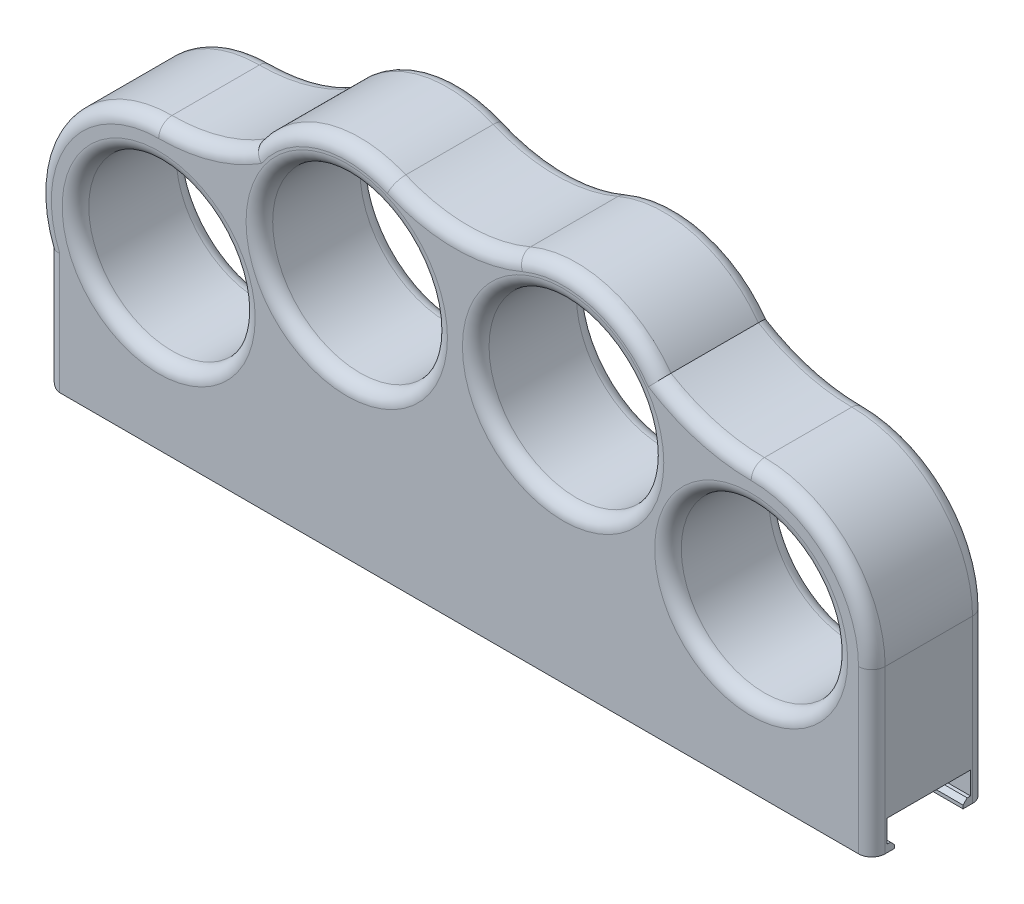
from build123d import *

# Parameters (mm, degrees)
CROQUIS1_R              = 10
CROQUIS1_R_2            = 10.5
SALIENTE_EXTRUIR1_DEPTH = 13.7
REDONDEO2_R             = 1.6
CROQUIS2_W              = 89.2
CROQUIS2_H              = 10.02
CORTAR_EXTRUIR1_DEPTH   = 3.6
SALIENTE_EXTRUIR3_DEPTH = 0.8999
CHAFL_N1_SIZE           = 0.5
REDONDEO6_R             = 1.6
CHAFL_N3_SIZE           = 0.5


with BuildPart() as part:
    # Croquis1 → Saliente-Extruir1 (new body)
    with BuildSketch(Plane.XY):
        with BuildLine():
            Line((-49.1, -10.791502622), (-49.1, -23))
            Line((-49.1, -23), (-49.1, -25))
            Line((-49.1, -25), (-47.1, -25))
            Line((-47.1, -25), (50.1, -25))
            Line((50.1, -25), (50.1, -5.5))
            ThreePointArc((50.1, -5.5), (45.853048327, 4.753048327), (35.6, 9))
            ThreePointArc((35.6, 9), (29.768537992, 9.805776707), (24.374092785, 12.162720951))
            ThreePointArc((24.374092785, 12.162720951), (16.763195532, 17.484745433), (7.496305975, 16.872814458))
            ThreePointArc((7.496305975, 16.872814458), (0, 15.337531488), (-7.496305975, 16.872814458))
            ThreePointArc((-7.496305975, 16.872814458), (-16.763195532, 17.484745433), (-24.374092785, 12.162720951))
            ThreePointArc((-24.374092785, 12.162720951), (-29.768537992, 9.805776707), (-35.6, 9))
            ThreePointArc((-35.6, 9), (-47.578664116, 2.670777563), (-49.1, -10.791502622))
        make_face()
        with Locations((-35.6, -5.5)):
            Circle(CROQUIS1_R, mode=Mode.SUBTRACT)
        with Locations((35.6, -5.5)):
            Circle(CROQUIS1_R, mode=Mode.SUBTRACT)
        with Locations((-13, 4)):
            Circle(CROQUIS1_R_2, mode=Mode.SUBTRACT)
        with BuildLine():
            ThreePointArc((21.483545292, -2.187039622), (3.016833529, 7.253672881), (23.5, 4))
            ThreePointArc((23.5, 4), (23.46396766, 3.130873539), (23.356117942, 2.267712157))
            ThreePointArc((23.356117942, 2.267712157), (22.679588371, -0.068853519), (21.483545292, -2.187039622))
        make_face(mode=Mode.SUBTRACT)
    extrude(amount=SALIENTE_EXTRUIR1_DEPTH)

    # Redondeo2
    redondeo2_edges = [part.edges().sort_by_distance(p)[0] for p in [
        (25.6, -5.5, 0),
        (25.6, -5.5, 13.7),
        (2.5, 4, 0),
        (2.5, 4, 13.7),
        (-23.5, 4, 0),
        (-23.5, 4, 13.7),
        (-45.6, -5.5, 0),
        (-45.6, -5.5, 13.7),
    ]]
    fillet(redondeo2_edges, radius=REDONDEO2_R)

    # Croquis2 → Cortar-Extruir1 (cut)
    with BuildSketch(Plane(origin=(0, -25, 0), x_dir=(-1, 0, 0), z_dir=(0, -1, 0))):
        with Locations((-5.5, -6.85)):
            Rectangle(CROQUIS2_W, CROQUIS2_H)
    extrude(amount=-CORTAR_EXTRUIR1_DEPTH, mode=Mode.SUBTRACT)

    # Croquis3 → Saliente-Extruir3 (add)
    with BuildSketch(Plane(origin=(0, -25, 0), x_dir=(-1, 0, 0), z_dir=(0, -1, 0))):
        Polygon((-50.1, -10.96), (-50.1, -11.86), (39.1, -11.86), (39.1, -1.84), (-50.1, -1.84), (-50.1, -2.74), (37.1, -2.74), (37.1, -10.96), align=None)
    extrude(amount=-SALIENTE_EXTRUIR3_DEPTH)

    # Chaflán1
    chafl_n1_edges = [part.edges().sort_by_distance(p)[0] for p in [
        (6.5, -24.1001, 10.96),
        (6.5, -24.1001, 2.74),
    ]]
    chamfer(chafl_n1_edges, length=CHAFL_N1_SIZE)

    # Redondeo6
    redondeo6_edges = [part.edges().sort_by_distance(p)[0] for p in [
        (29.768537992, 9.805776707, 0),
        (45.853048327, 4.753048327, 0),
        (29.768537992, 9.805776707, 13.7),
        (45.853048327, 4.753048327, 13.7),
        (50.1, -15.25, 0),
        (50.1, -15.25, 13.7),
        (-29.768537992, 9.805776707, 13.7),
        (-29.768537992, 9.805776707, 0),
        (-49.1, -17.895751311, 0),
        (-47.578664116, 2.670777563, 13.7),
        (-47.578664116, 2.670777563, 0),
        (-49.1, -17.895751311, 13.7),
        (-16.763195532, 17.484745433, 13.7),
        (0, 15.337531488, 13.7),
        (16.763195532, 17.484745433, 0),
        (0, 15.337531488, 0),
        (-49.1, -25, 6.85),
        (16.763195532, 17.484745433, 13.7),
        (-16.763195532, 17.484745433, 0),
    ]]
    fillet(redondeo6_edges, radius=REDONDEO6_R)

    # Chaflán3
    chafl_n3_edges = [part.edges().sort_by_distance(p)[0] for p in [
        (-37.1, -24.1001, 6.85),
    ]]
    chamfer(chafl_n3_edges, length=CHAFL_N3_SIZE)


solid = part.part
